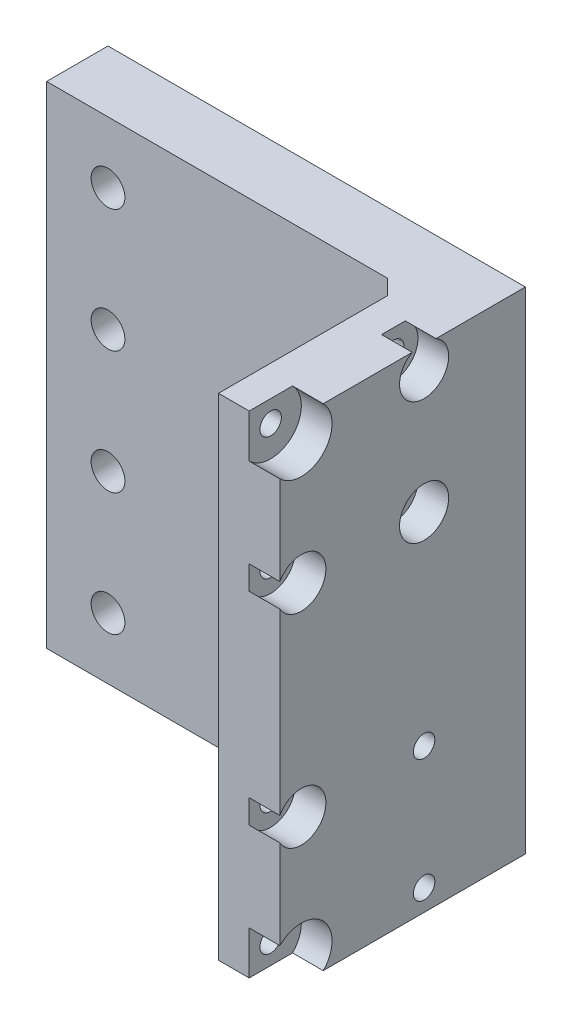
from build123d import *

# Parameters (mm, degrees)
ESQUISSE1_W             = 68
ESQUISSE1_H             = 80
ESQUISSE1_R             = 2.75
BOSS_EXTRU_1_DEPTH      = 10
ESQUISSE2_W             = 10
ESQUISSE2_H             = 80
BOSS_EXTRU_2_DEPTH      = 30
ENL_V_MAT_EXTRU_1_REACH = 98.544
ESQUISSE3_R             = 1.75
ESQUISSE5_R             = 5
ESQUISSE5_R_2           = 4
ENL_V_MAT_EXTRU_3_DEPTH = 5
ESQUISSE4_R             = 6
ENL_V_MAT_EXTRU_2_DEPTH = 5
CHANFREIN1_SIZE         = 2.5


with BuildPart() as part:
    # Esquisse1 → Boss.-Extru.1 (new body)
    with BuildSketch(Plane.XY):
        with Locations((0.603127642, -15.648351648)):
            Rectangle(ESQUISSE1_W, ESQUISSE1_H)
        with Locations((-23.396872358, 14.351648352)):
            Circle(ESQUISSE1_R, mode=Mode.SUBTRACT)
        with Locations((-23.396872358, -5.648351648)):
            Circle(ESQUISSE1_R, mode=Mode.SUBTRACT)
        with Locations((-23.396872358, -25.648351648)):
            Circle(ESQUISSE1_R, mode=Mode.SUBTRACT)
        with Locations((-23.396872358, -45.648351648)):
            Circle(ESQUISSE1_R, mode=Mode.SUBTRACT)
    extrude(amount=BOSS_EXTRU_1_DEPTH)

    # Esquisse2 → Boss.-Extru.2 (add)
    with BuildSketch(Plane(origin=(0, 0, 10), x_dir=(-1, 0, 0), z_dir=(0, 0, -1))):
        with Locations((-29.603127642, -15.648351648)):
            Rectangle(ESQUISSE2_W, ESQUISSE2_H)
    extrude(amount=-BOSS_EXTRU_2_DEPTH)

    # Esquisse3 → Enlèv. mat.-Extru.1 (cut, up to next)
    with BuildSketch(Plane(origin=(34.603127642, 0, 0), x_dir=(0, 0, -1), z_dir=(1, 0, 0)), mode=Mode.PRIVATE) as enl_v_mat_extru_1_sk1:
        with Locations((-36.5, -52.148351648)):
            Circle(ESQUISSE3_R)
    enl_v_mat_extru_1_tool1 = extrude(enl_v_mat_extru_1_sk1.sketch, amount=-ENL_V_MAT_EXTRU_1_REACH, mode=Mode.PRIVATE) & part.part
    # Esquisse3 → Enlèv. mat.-Extru.1 (cut, up to next)
    with BuildSketch(Plane(origin=(34.603127642, 0, 0), x_dir=(0, 0, -1), z_dir=(1, 0, 0)), mode=Mode.PRIVATE) as enl_v_mat_extru_1_sk2:
        with Locations((-36.5, -32.148351648)):
            Circle(ESQUISSE3_R)
    enl_v_mat_extru_1_tool2 = extrude(enl_v_mat_extru_1_sk2.sketch, amount=-ENL_V_MAT_EXTRU_1_REACH, mode=Mode.PRIVATE) & part.part
    # Esquisse3 → Enlèv. mat.-Extru.1 (cut, up to next)
    with BuildSketch(Plane(origin=(34.603127642, 0, 0), x_dir=(0, 0, -1), z_dir=(1, 0, 0)), mode=Mode.PRIVATE) as enl_v_mat_extru_1_sk3:
        with Locations((-16.5, -32.148351648)):
            Circle(ESQUISSE3_R)
    enl_v_mat_extru_1_tool3 = extrude(enl_v_mat_extru_1_sk3.sketch, amount=-ENL_V_MAT_EXTRU_1_REACH, mode=Mode.PRIVATE) & part.part
    # Esquisse3 → Enlèv. mat.-Extru.1 (cut, up to next)
    with BuildSketch(Plane(origin=(34.603127642, 0, 0), x_dir=(0, 0, -1), z_dir=(1, 0, 0)), mode=Mode.PRIVATE) as enl_v_mat_extru_1_sk4:
        with Locations((-16.5, -52.148351648)):
            Circle(ESQUISSE3_R)
    enl_v_mat_extru_1_tool4 = extrude(enl_v_mat_extru_1_sk4.sketch, amount=-ENL_V_MAT_EXTRU_1_REACH, mode=Mode.PRIVATE) & part.part
    # Esquisse3 → Enlèv. mat.-Extru.1 (cut, up to next)
    with BuildSketch(Plane(origin=(34.603127642, 0, 0), x_dir=(0, 0, -1), z_dir=(1, 0, 0)), mode=Mode.PRIVATE) as enl_v_mat_extru_1_sk5:
        with Locations((-36.5, 0.851648352)):
            Circle(ESQUISSE3_R)
    enl_v_mat_extru_1_tool5 = extrude(enl_v_mat_extru_1_sk5.sketch, amount=-ENL_V_MAT_EXTRU_1_REACH, mode=Mode.PRIVATE) & part.part
    # Esquisse3 → Enlèv. mat.-Extru.1 (cut, up to next)
    with BuildSketch(Plane(origin=(34.603127642, 0, 0), x_dir=(0, 0, -1), z_dir=(1, 0, 0)), mode=Mode.PRIVATE) as enl_v_mat_extru_1_sk6:
        with Locations((-36.5, 20.851648352)):
            Circle(ESQUISSE3_R)
    enl_v_mat_extru_1_tool6 = extrude(enl_v_mat_extru_1_sk6.sketch, amount=-ENL_V_MAT_EXTRU_1_REACH, mode=Mode.PRIVATE) & part.part
    # Esquisse3 → Enlèv. mat.-Extru.1 (cut, up to next)
    with BuildSketch(Plane(origin=(34.603127642, 0, 0), x_dir=(0, 0, -1), z_dir=(1, 0, 0)), mode=Mode.PRIVATE) as enl_v_mat_extru_1_sk7:
        with Locations((-16.5, 20.851648352)):
            Circle(ESQUISSE3_R)
    enl_v_mat_extru_1_tool7 = extrude(enl_v_mat_extru_1_sk7.sketch, amount=-ENL_V_MAT_EXTRU_1_REACH, mode=Mode.PRIVATE) & part.part
    # Esquisse3 → Enlèv. mat.-Extru.1 (cut, up to next)
    with BuildSketch(Plane(origin=(34.603127642, 0, 0), x_dir=(0, 0, -1), z_dir=(1, 0, 0)), mode=Mode.PRIVATE) as enl_v_mat_extru_1_sk8:
        with Locations((-16.5, 0.851648352)):
            Circle(ESQUISSE3_R)
    enl_v_mat_extru_1_tool8 = extrude(enl_v_mat_extru_1_sk8.sketch, amount=-ENL_V_MAT_EXTRU_1_REACH, mode=Mode.PRIVATE) & part.part
    add(enl_v_mat_extru_1_tool1.solids().sort_by_distance((34.603128, -52.148352, 36.5))[0], mode=Mode.SUBTRACT)
    add(enl_v_mat_extru_1_tool2.solids().sort_by_distance((34.603128, -32.148352, 36.5))[0], mode=Mode.SUBTRACT)
    add(enl_v_mat_extru_1_tool3.solids().sort_by_distance((34.603128, -32.148352, 16.5))[0], mode=Mode.SUBTRACT)
    add(enl_v_mat_extru_1_tool4.solids().sort_by_distance((34.603128, -52.148352, 16.5))[0], mode=Mode.SUBTRACT)
    add(enl_v_mat_extru_1_tool5.solids().sort_by_distance((34.603128, 0.851648, 36.5))[0], mode=Mode.SUBTRACT)
    add(enl_v_mat_extru_1_tool6.solids().sort_by_distance((34.603128, 20.851648, 36.5))[0], mode=Mode.SUBTRACT)
    add(enl_v_mat_extru_1_tool7.solids().sort_by_distance((34.603128, 20.851648, 16.5))[0], mode=Mode.SUBTRACT)
    add(enl_v_mat_extru_1_tool8.solids().sort_by_distance((34.603128, 0.851648, 16.5))[0], mode=Mode.SUBTRACT)

    # Esquisse5 → Enlèv. mat.-Extru.3 (cut)
    with BuildSketch(Plane(origin=(34.603127642, 0, 0), x_dir=(0, 0, -1), z_dir=(1, 0, 0))):
        with Locations((-36.5, -52.148351648)):
            Circle(ESQUISSE5_R)
        with Locations((-36.5, -32.148351648)):
            Circle(ESQUISSE5_R_2)
        with Locations((-36.5, 0.851648352)):
            Circle(ESQUISSE5_R_2)
        with Locations((-36.5, 20.851648352)):
            Circle(ESQUISSE5_R)
        with Locations((-16.5, 20.851648352)):
            Circle(ESQUISSE5_R_2)
        with Locations((-16.5, 0.851648352)):
            Circle(ESQUISSE5_R_2)
    extrude(amount=-ENL_V_MAT_EXTRU_3_DEPTH, mode=Mode.SUBTRACT)

    # Esquisse4 → Enlèv. mat.-Extru.2 (cut)
    with BuildSketch(Plane(origin=(0, 0, 0), x_dir=(-1, 0, 0), z_dir=(0, 0, -1))):
        with Locations((23.396872358, -45.648351648)):
            Circle(ESQUISSE4_R)
        with Locations((23.396872358, -25.648351648)):
            Circle(ESQUISSE4_R)
        with Locations((23.396872358, -5.648351648)):
            Circle(ESQUISSE4_R)
        with Locations((23.396872358, 14.351648352)):
            Circle(ESQUISSE4_R)
    extrude(amount=-ENL_V_MAT_EXTRU_2_DEPTH, mode=Mode.SUBTRACT)

    # Chanfrein1
    chanfrein1_edges = [part.edges().sort_by_distance(p)[0] for p in [
        (24.603127642, -15.648351648, 10),
    ]]
    chamfer(chanfrein1_edges, length=CHANFREIN1_SIZE)


solid = part.part
